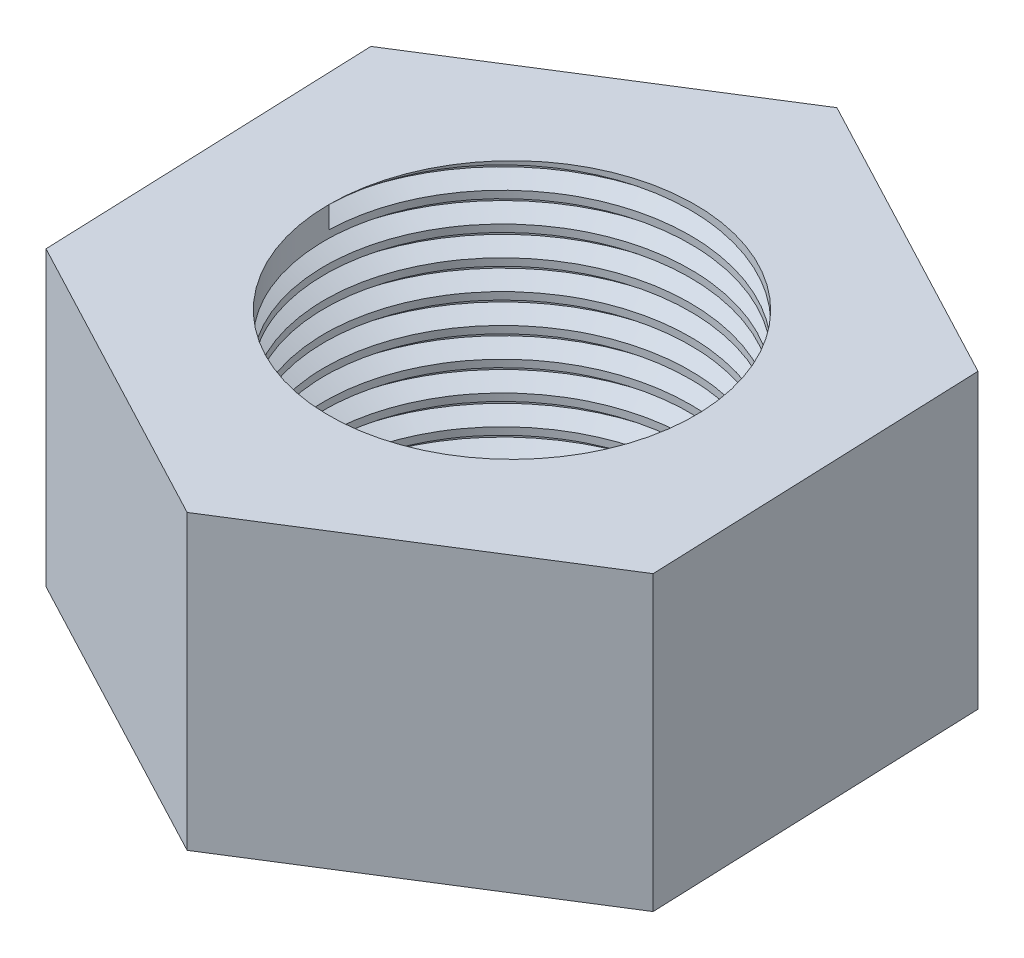
from build123d import *

# Parameters (mm, degrees)
AUFSATZ_LINEAR_AUSTRAGEN1_DEPTH = 4
SKIZZE2_R                       = 2.5
SCHNITT_LINEAR_AUSTRAGEN1_DEPTH = 4
GEWINDE1_PITCH                  = 0.4


with BuildPart() as part:
    # Skizze1 → Aufsatz-Linear austragen1 (new body)
    with BuildSketch(Plane(origin=(0, 0, 0), x_dir=(1, 0, 0), z_dir=(0, 1, 0))):
        Polygon((4.084798201, -2.155865717), (3.909433579, 2.459606153), (-0.175364622, 4.61547187), (-4.084798201, 2.155865717), (-3.909433579, -2.459606153), (0.175364622, -4.61547187), align=None)
    extrude(amount=AUFSATZ_LINEAR_AUSTRAGEN1_DEPTH)

    # Skizze2 → Schnitt-Linear austragen1 (cut)
    with BuildSketch(Plane.XZ):
        with Locations(Location((0, 0, 0), (0, 0, 270))):
            Circle(SKIZZE2_R)
    extrude(amount=-SCHNITT_LINEAR_AUSTRAGEN1_DEPTH, mode=Mode.SUBTRACT)

    # Gewinde1: the profile of Gewindeprofil1 profile screwed along a right-hand helix of 10 turns, 6 arcs to a turn; built about Z, then put on its axis
    gewinde1_z = Axis((0, 0, 0), (0, 0, 1))
    gewinde1_corners = [(2.4997, 0, -0.000173205), (2.71650635, 0, 0.124999999), (2.71650635, 0, 0.174999999), (2.4997, 0, 0.300173204)]
    with BuildLine(mode=Mode.PRIVATE) as gewinde1_profile:
        Line(gewinde1_corners[0], gewinde1_corners[1])
        Line(gewinde1_corners[1], gewinde1_corners[2])
        Line(gewinde1_corners[2], gewinde1_corners[3])
        Line(gewinde1_corners[3], gewinde1_corners[0])
    gewinde1_cap = Face(gewinde1_profile.wire())
    gewinde1_turn_angles = [0, 30, 60, 90, 120, 150, 180, 210, 240, 270, 300, 330, 360]
    gewinde1_turn_weights = [1, 0.8660254037844387, 1, 0.8660254037844387, 1, 0.8660254037844387, 1, 0.8660254037844387, 1, 0.8660254037844387, 1, 0.8660254037844387, 1]
    gewinde1_turn_rails = [Edge.make_bspline([Vector(p[0], p[1], 0).rotate(gewinde1_z, gewinde1_turn_angles[k]) / gewinde1_turn_weights[k] + Vector(0, 0, p[2] + GEWINDE1_PITCH * gewinde1_turn_angles[k] / 360) for k in range(13)], [0, 0, 0, 1, 1, 2, 2, 3, 3, 4, 4, 5, 5, 6, 6, 6], 2, gewinde1_turn_weights) for p in gewinde1_corners]
    gewinde1_turn_sides = [Face.make_surface_from_curves(gewinde1_turn_rails[p[0]], gewinde1_turn_rails[p[1]]) for p in [(0, 1), (1, 2), (2, 3), (3, 0)]]
    gewinde1 = Plane(origin=(0, 4, 0), x_dir=(-1, 0, 0), z_dir=(0, -1, 0)) * Solid(Shell([*[p.moved(Location((0, 0, GEWINDE1_PITCH * i))) for i in range(10) for p in gewinde1_turn_sides], gewinde1_cap, gewinde1_cap.rotate(gewinde1_z, 3600).moved(Location((0, 0, GEWINDE1_PITCH * 3600 / 360)))]))
    add(gewinde1, mode=Mode.SUBTRACT)


solid = part.part
